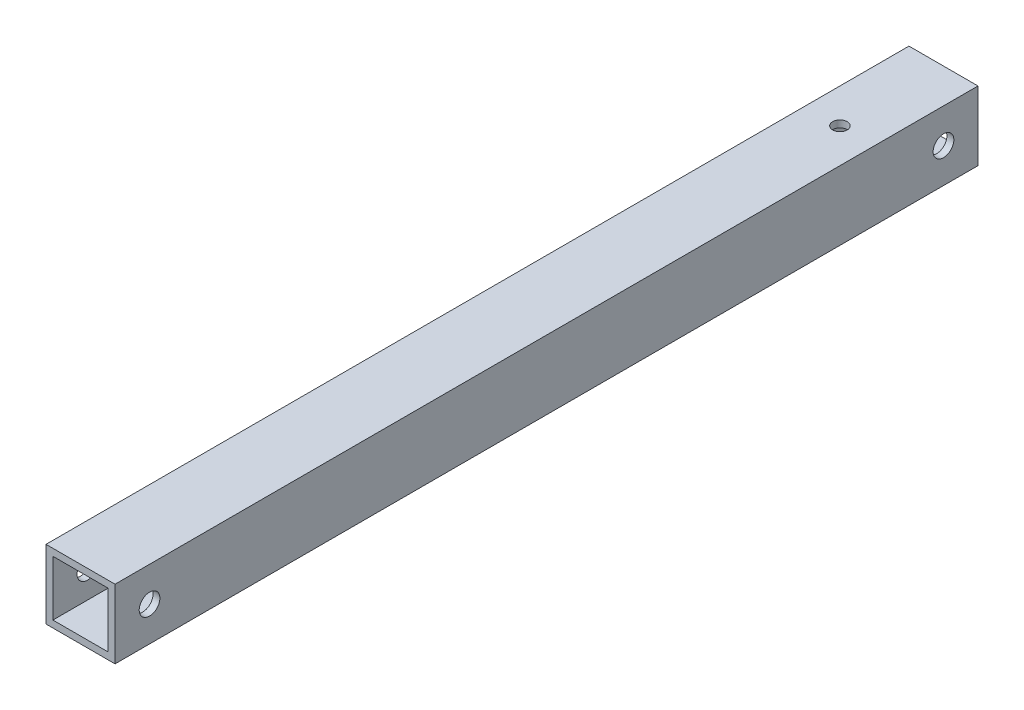
from build123d import *

# Parameters (mm, degrees)
SZKIC1_W                    = 20
SZKIC1_H                    = 20
SZKIC1_W_2                  = 16
SZKIC1_H_2                  = 16
DODANIE_WYCI_GNI_CIE1_DEPTH = 250
SZKIC2_R                    = 3
WYTNIJ_WYCI_GNI_CIE1_DEPTH  = 251.99800796
SZKIC3_R                    = 2.1
WYTNIJ_WYCI_GNI_CIE2_DEPTH  = 251.99800796


with BuildPart() as part:
    # Szkic1 → Dodanie-wyciągnięcie1 (new body)
    with BuildSketch(Plane.XY):
        Rectangle(SZKIC1_W, SZKIC1_H)
        Rectangle(SZKIC1_W_2, SZKIC1_H_2, mode=Mode.SUBTRACT)
    extrude(amount=DODANIE_WYCI_GNI_CIE1_DEPTH)

    # Szkic2 → Wytnij-wyciągnięcie1 (cut, through all)
    with BuildSketch(Plane(origin=(10, 0, 0), x_dir=(0, 0, -1), z_dir=(1, 0, 0))):
        with Locations((-10, 0)):
            Circle(SZKIC2_R)
        with Locations((-240, 0)):
            Circle(SZKIC2_R)
    extrude(amount=-WYTNIJ_WYCI_GNI_CIE1_DEPTH, mode=Mode.SUBTRACT)

    # Szkic3 → Wytnij-wyciągnięcie2 (cut, through all)
    with BuildSketch(Plane(origin=(0, 10, 0), x_dir=(1, 0, 0), z_dir=(0, 1, 0))):
        with Locations((0, -30)):
            Circle(SZKIC3_R)
    extrude(amount=-WYTNIJ_WYCI_GNI_CIE2_DEPTH, mode=Mode.SUBTRACT)


solid = part.part
